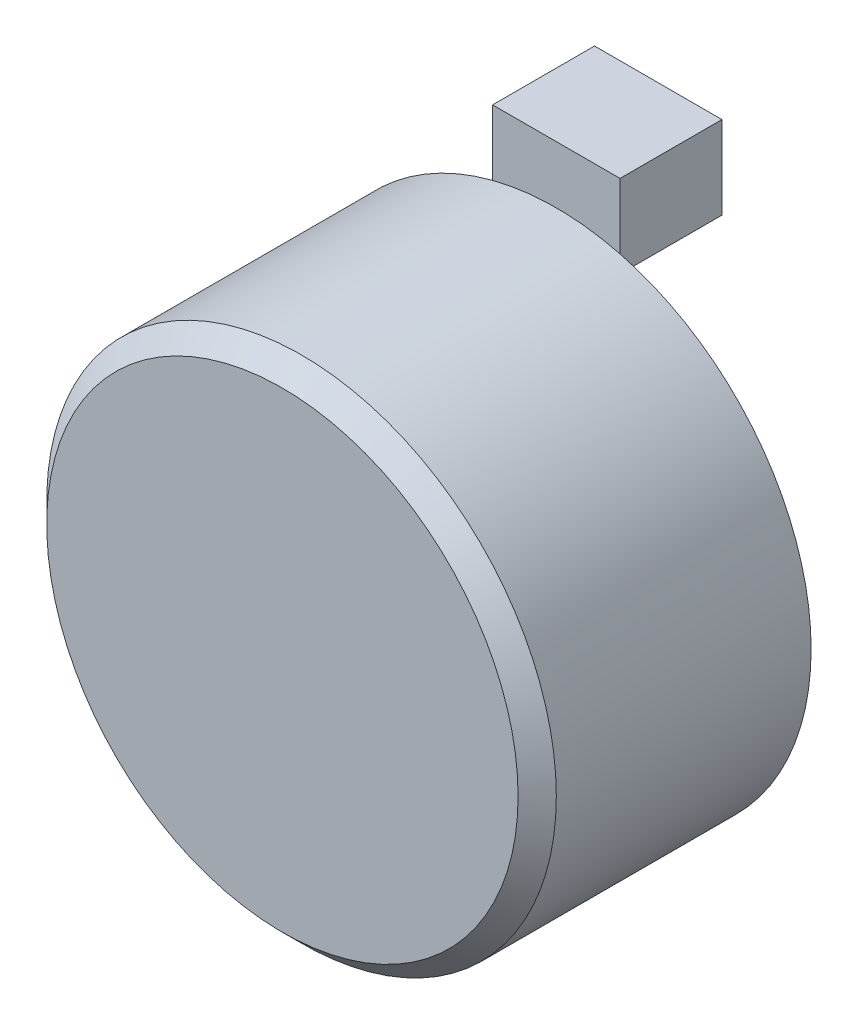
from build123d import *

# Parameters (mm, degrees)
SK_REARHOLE_R           = 1.25
REAR_TAPPED_HOLE_DEPTH  = 8
REAR_HOLE_PATTERN_COUNT = 6
SK_CONNECTOR_W          = 20
SK_CONNECTOR_H          = 13
CONNECTOR_ZONE_DEPTH    = 16


with BuildPart() as part:
    # SK_Body → Housing_Body (revolve)
    with BuildSketch(Plane(origin=(0, 0, 0), x_dir=(1, 0, 0), z_dir=(0, 1, 0))):
        Polygon((0, 0), (37, 0), (40, 3), (40, 43), (37, 43), (0, 43), align=None)
    revolve(axis=Axis((0, 0, 10), (0, 0, -1)))

    # SK_RearHole → Rear_Tapped_Hole (cut)
    with BuildSketch(Plane.XY.offset(-43)):
        with Locations((34, 0)):
            Circle(SK_REARHOLE_R)
    rear_tapped_hole = extrude(amount=REAR_TAPPED_HOLE_DEPTH, mode=Mode.SUBTRACT)

    # Rear_Hole_Pattern: Rear_Tapped_Hole ×6 about axis
    rear_hole_pattern_axis = Axis((0, 0, -61.95), (0, 0, 1))
    for i in range(1, REAR_HOLE_PATTERN_COUNT):
        add(rear_tapped_hole.rotate(rear_hole_pattern_axis, i * 360 / REAR_HOLE_PATTERN_COUNT), mode=Mode.SUBTRACT)

    # SK_Connector → Connector_Zone (add)
    with BuildSketch(Plane.XY.offset(-43)):
        with Locations((0, 42.5)):
            Rectangle(SK_CONNECTOR_W, SK_CONNECTOR_H)
    extrude(amount=-CONNECTOR_ZONE_DEPTH)


solid = part.part
